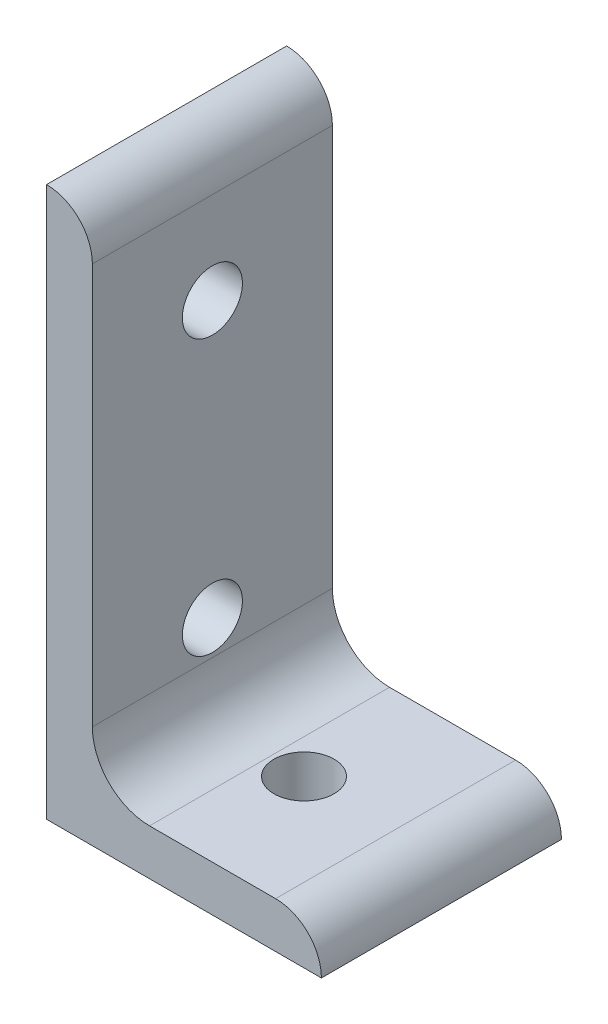
from build123d import *

# Parameters (mm, degrees)
BOSS_EXTRUDE1_DEPTH = 16.637
FILLET1_R           = 6.35
SKETCH3_R           = 4.1656
CUT_EXTRUDE1_DEPTH  = 87.803454822
SKETCH4_R           = 4.1656
CUT_EXTRUDE2_DEPTH  = 87.803454822


with BuildPart() as part:
    # Sketch2 → Boss-Extrude1 (new, symmetric)
    with BuildSketch(Plane.XY):
        with BuildLine():
            Line((0, 0), (0, 76.2))
            Line((0, 76.2), (6.35, 76.2))
            Line((6.35, 76.2), (6.35, 14.2748))
            ThreePointArc((6.35, 14.2748), (8.67112018, 8.67112018), (14.2748, 6.35))
            Line((14.2748, 6.35), (38.1, 6.35))
            Line((38.1, 6.35), (38.1, 0))
            Line((38.1, 0), (0, 0))
        make_face()
    extrude(amount=BOSS_EXTRUDE1_DEPTH, both=True)

    # Fillet1
    fillet1_edges = [part.edges().sort_by_distance(p)[0] for p in [
        (38.1, 6.35, 0),
        (6.35, 76.2, 0),
    ]]
    fillet(fillet1_edges, radius=FILLET1_R - 0.0001)  # a hair under: the kernel refuses the full size

    # Sketch3 → Cut-Extrude1 (cut, through all)
    with BuildSketch(Plane.ZY):
        with Locations(Location((0, 57.15, 0), (0, 0, 270))):
            Circle(SKETCH3_R)
        with Locations(Location((0, 19.05, 0), (0, 0, 270))):
            Circle(SKETCH3_R)
    extrude(amount=-CUT_EXTRUDE1_DEPTH, mode=Mode.SUBTRACT)

    # Sketch4 → Cut-Extrude2 (cut, through all)
    with BuildSketch(Plane.XZ):
        with Locations((19.05, 0)):
            Circle(SKETCH4_R)
    extrude(amount=-CUT_EXTRUDE2_DEPTH, mode=Mode.SUBTRACT)


solid = part.part
